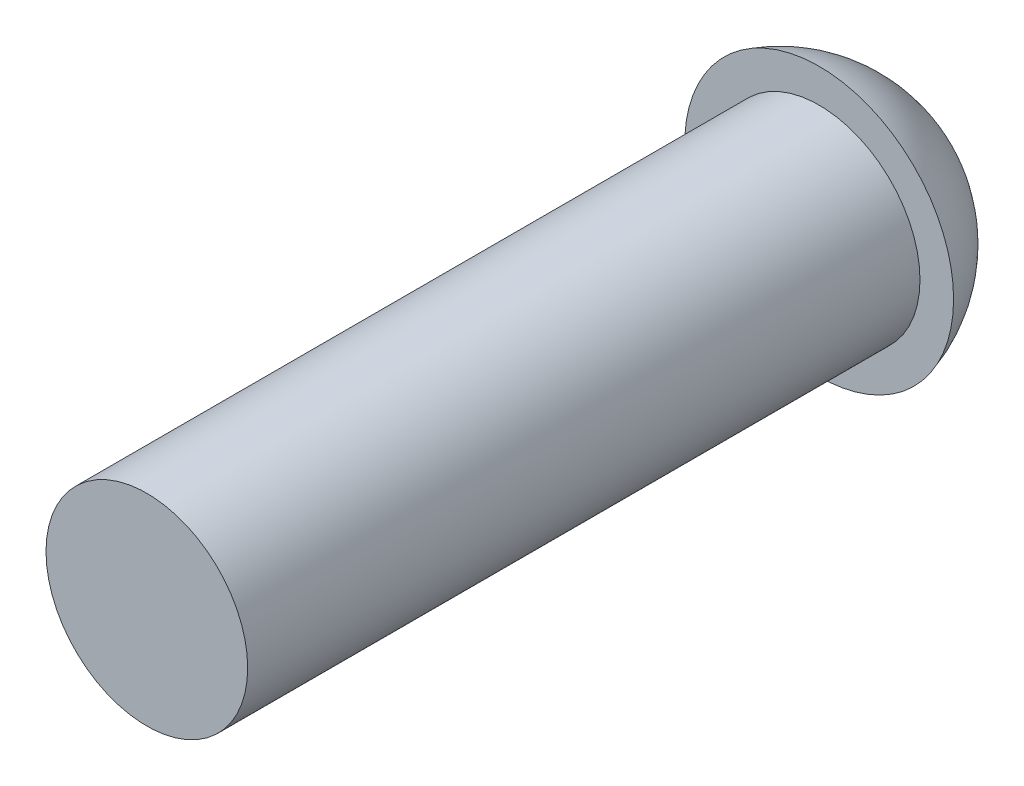
from build123d import *

# Parameters (mm, degrees)
CROQUIS2_R                   = 1.5
SALIENTE_EXTRUIR1_DEPTH      = 10
CORTAR_EXTRUIR_L_MINA2_START = -0.6
CORTAR_EXTRUIR_L_MINA2_DEPTH = 0.6


# Read off the part's stored shape, not the designer's step: Cortar-Extruir-Lámina2
with BuildPart() as part:
    # Croquis2 → Saliente-Extruir1 (new body)
    with BuildSketch(Plane.XY):
        Circle(CROQUIS2_R)
    extrude(amount=-SALIENTE_EXTRUIR1_DEPTH)

    # Croquis4 → Revolución1 (revolve)
    with BuildSketch(Plane(origin=(0, 0, 0), x_dir=(1, 0, 0), z_dir=(0, 1, 0))):
        with BuildLine():
            Line((2, 10), (0, 10))
            Line((0, 10), (0, 11.5))
            ThreePointArc((0, 11.5), (1.25, 11.083333333), (2, 10))
        make_face()
    revolve(axis=Axis((0, 0, -10), (0, 0, -1)))

    # Cortar-Extruir-Lámina2 outline → Cortar-Extruir-Lámina2 (cut)
    with BuildSketch(Plane(origin=(0, 0, -11.5), x_dir=(-1, 0, 0), z_dir=(0, 0, -1)).offset(CORTAR_EXTRUIR_L_MINA2_START)):
        Polygon((0.1, -1), (0.1, -0.1), (1, -0.1), (1, 0.1), (0.1, 0.1), (0.1, 1), (-0.1, 1), (-0.1, 0.1), (-1, 0.1), (-1, -0.1), (-0.1, -0.1), (-0.1, -1), align=None)
    extrude(amount=CORTAR_EXTRUIR_L_MINA2_DEPTH, mode=Mode.SUBTRACT)


solid = part.part
